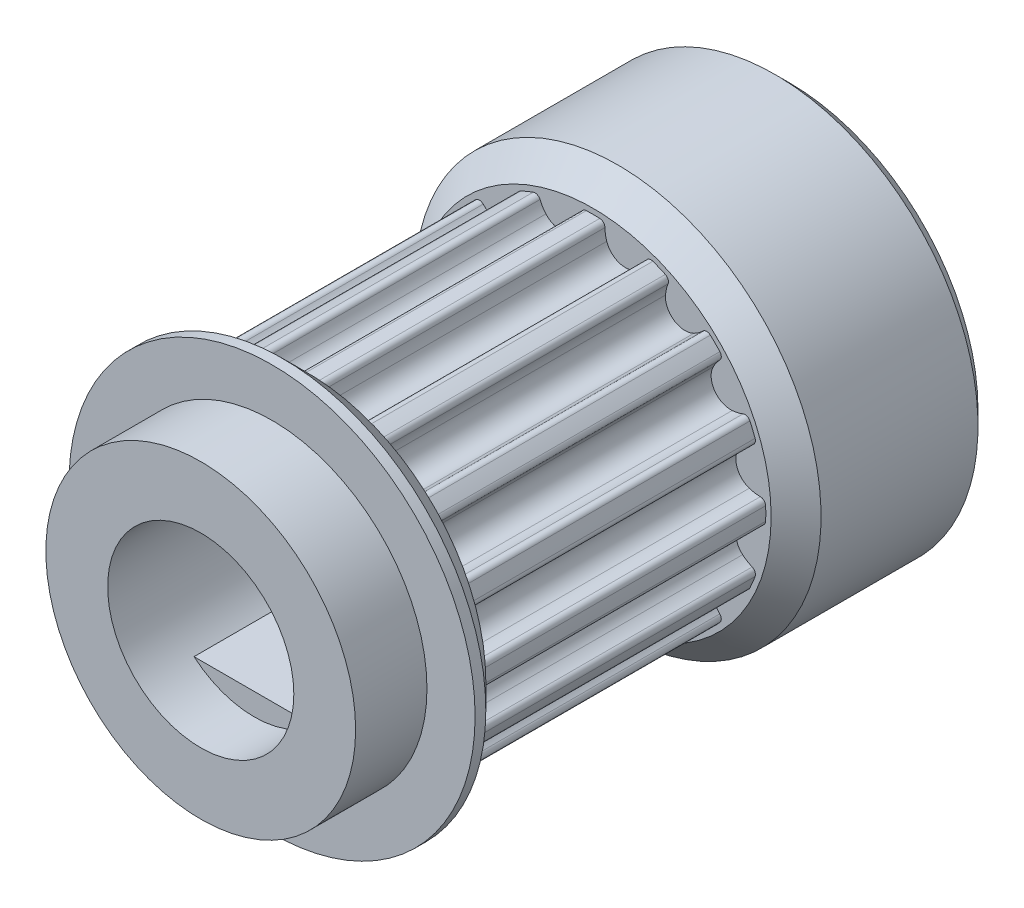
from build123d import *

# Parameters (mm, degrees)
SKETCH1_R               = 5.092958179
BOSS_EXTRUDE1_DEPTH     = 4
CUT_EXTRUDE1_DEPTH      = 8
CIRPATTERN1_COUNT       = 16
SKETCH4_R               = 5.692958179
BOSS_EXTRUDE2_DEPTH     = 1
CHAMFER1_SIZE           = 0.7
SKETCH5_R               = 2.61
CUT_EXTRUDE2_DEPTH      = 13.838206481
BOSS_EXTRUDE3_START     = 2
SKETCH6_R               = 4.342958179
SKETCH6_R_2             = 2.61
BOSS_EXTRUDE3_DEPTH     = 2
BOSS_EXTRUDE4_START     = -1.5
BOSS_EXTRUDE4_DEPTH     = 10.5
CHAMFER3_SIZE           = 0.7
BOSS_EXTRUDE5_OUTLINE_R = 5.692958179
BOSS_EXTRUDE5_DEPTH     = 4.5
CHAMFER4_SIZE           = 0.4


# Read off the part's stored shape, not the designer's step: Boss-Extrude5
with BuildPart() as part:
    # Sketch1 → Boss-Extrude1 (new, symmetric)
    with BuildSketch(Plane.XY):
        Circle(SKETCH1_R)
    extrude(amount=BOSS_EXTRUDE1_DEPTH, both=True)

    # Sketch3 → Cut-Extrude1 (cut)
    with BuildSketch(Plane.XY.offset(4)):
        with BuildLine():
            Line((0, 5.092958179), (0, 4.842958179))
            ThreePointArc((0, 4.842958179), (0.094432569, 4.842037424), (0.188829231, 4.839275508))
            ThreePointArc((0.188829231, 4.839275508), (0.290828985, 4.793642815), (0.332978706, 4.690155166))
            ThreePointArc((0.332978706, 4.690155166), (0.346140453, 4.533469242), (0.383700181, 4.380783365))
            ThreePointArc((0.383700181, 4.380783365), (0.798496529, 4.014313135), (1.32196047, 4.19415179))
            ThreePointArc((1.32196047, 4.19415179), (1.41509149, 4.320841661), (1.487212466, 4.460563797))
            ThreePointArc((1.487212466, 4.460563797), (1.565756739, 4.540043917), (1.6774551, 4.543169413))
            ThreePointArc((1.6774551, 4.543169413), (1.765723183, 4.509597051), (1.853319859, 4.474309938))
            Line((1.853319859, 4.474309938), (1.948990717, 4.705279821))
            ThreePointArc((1.948990717, 4.705279821), (0.993586851, 4.995098416), (0, 5.092958179))
        make_face()
    cut_extrude1 = extrude(amount=-CUT_EXTRUDE1_DEPTH, mode=Mode.SUBTRACT)

    # CirPattern1: Cut-Extrude1 ×16 about axis
    cirpattern1_axis = Axis((0, 0, 0), (0, 0, 1))
    for i in range(1, CIRPATTERN1_COUNT):
        add(cut_extrude1.rotate(cirpattern1_axis, i * 360 / CIRPATTERN1_COUNT), mode=Mode.SUBTRACT)

    # Sketch4 → Boss-Extrude2 (add)
    with BuildSketch(Plane.XY.offset(4)):
        Circle(SKETCH4_R)
    boss_extrude2 = extrude(amount=BOSS_EXTRUDE2_DEPTH)

    # Mirror1: Boss-Extrude2 across plane
    add(boss_extrude2.mirror(Plane.XY))

    # Chamfer1
    chamfer1_edges = [part.edges().sort_by_distance(p)[0] for p in [
        (-5.692958179, 0, -4),
    ]]
    chamfer(chamfer1_edges, length=CHAMFER1_SIZE)

    # Sketch5 → Cut-Extrude2 (cut, through all)
    with BuildSketch(Plane.XY.offset(5)):
        Circle(SKETCH5_R)
    extrude(amount=-CUT_EXTRUDE2_DEPTH, mode=Mode.SUBTRACT)

    # Sketch6 → Boss-Extrude3 (add)
    with BuildSketch(Plane.XY.offset(5).offset(BOSS_EXTRUDE3_START)):
        Circle(SKETCH6_R)
        Circle(SKETCH6_R_2, mode=Mode.SUBTRACT)
    extrude(amount=-BOSS_EXTRUDE3_DEPTH)

    # Sketch7 → Boss-Extrude4 (add)
    with BuildSketch(Plane.XY.offset(7).offset(BOSS_EXTRUDE4_START)):
        with BuildLine():
            Line((1.688786547, -1.99), (-1.688786547, -1.99))
            ThreePointArc((-1.688786547, -1.99), (0, -2.61), (1.688786547, -1.99))
        make_face()
    extrude(amount=-BOSS_EXTRUDE4_DEPTH)

    # Chamfer3
    chamfer3_edges = [part.edges().sort_by_distance(p)[0] for p in [
        (-5.692958179, 0, 4),
    ]]
    chamfer(chamfer3_edges, length=CHAMFER3_SIZE)

    # Boss-Extrude5 outline → Boss-Extrude5 (add)
    with BuildSketch(Plane(origin=(0, 0, -5), x_dir=(-1, 0, 0), z_dir=(0, 0, -1))):
        Circle(BOSS_EXTRUDE5_OUTLINE_R)
        with BuildLine():
            Line((1.688786547, -1.99), (-1.688786547, -1.99))
            ThreePointArc((-1.688786547, -1.99), (0, 2.61), (1.688786547, -1.99))
        make_face(mode=Mode.SUBTRACT)
    extrude(amount=BOSS_EXTRUDE5_DEPTH)

    # Chamfer4
    chamfer4_edges = [part.edges().sort_by_distance(p)[0] for p in [
        (0, 2.61, -9.5),
        (0, -1.99, -9.5),
        (5.692958179, 0, -9.5),
    ]]
    chamfer(chamfer4_edges, length=CHAMFER4_SIZE)


solid = part.part
